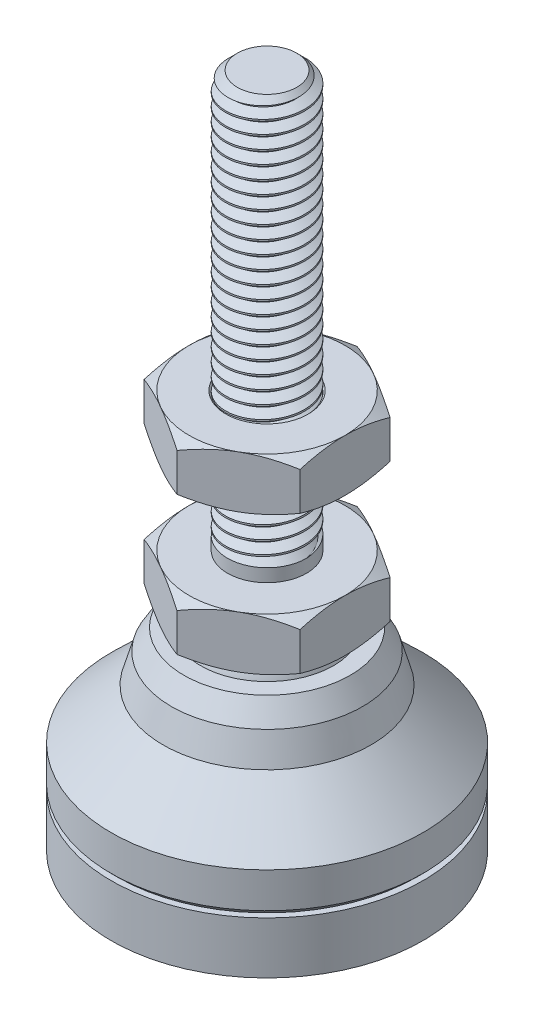
from build123d import *
from build123d.topology import SkipClean

# Parameters (mm, degrees)
BOSS_EXTRUDE1_DEPTH = 3.175
SKETCH6_R           = 2.413
BOSS_EXTRUDE2_DEPTH = 25.4
CUT_SWEEP1_PITCH    = 0.79375
CUT_SWEEP1_TO       = 25.4
SKETCH9_OUTSIDE_W   = 81.182
SKETCH9_OUTSIDE_H   = 81.182
SKETCH9_OUTSIDE_R   = 1.811518294
CUT_EXTRUDE1_DEPTH  = 25.4
CUT_EXTRUDE1_DRAFT  = -45
SKETCH10_R          = 2.413
BOSS_EXTRUDE3_DEPTH = 3.175
SKETCH14_W          = 9.525
SKETCH14_H          = 3.175


with BuildPart() as part:
    # Sketch2 → Revolve1 (revolve)
    with BuildSketch(Plane.XY, mode=Mode.PRIVATE) as revolve1_sk:
        with BuildLine():
            Line((0, 3.175), (0, 6.2865))
            ThreePointArc((0, 6.2865), (-3.428117942, 8.02132192), (-4.060525859, 11.811))
            Line((-4.060525859, 11.811), (-5.08, 11.811))
            Line((-5.08, 11.811), (-5.842, 10.541))
            Line((-5.842, 10.541), (-6.35, 8.763))
            Line((-6.35, 8.763), (-9.525, 5.715))
            Line((-9.525, 5.715), (-9.525, 3.556))
            Line((-9.525, 3.556), (-9.144, 3.175))
            Line((-9.144, 3.175), (0, 3.175))
        make_face()
    revolve(revolve1_sk.sketch.rotate(Axis((0, 0, 0), (0, 1, 0)), 270), axis=Axis((0, 0, 0), (0, 1, 0)))


with BuildPart() as body_2:
    # Sketch12 → Revolve2 (revolve)
    with BuildSketch(Plane.XY, mode=Mode.PRIVATE) as revolve2_sk:
        with BuildLine():
            Line((0, 12.7), (-3.665990896, 12.7))
            ThreePointArc((-3.665990896, 12.7), (-3.693659144, 8.429684681), (0, 6.2865))
            Line((0, 6.2865), (0, 12.7))
        make_face()
    revolve(revolve2_sk.sketch.rotate(Axis((0, 12.7, 0), (0, -1, 0)), 180), axis=Axis((0, 12.7, 0), (0, -1, 0)))

    # Sketch4 → Boss-Extrude1 (add)
    with BuildSketch(Plane(origin=(0, 12.7, 0), x_dir=(1, 0, 0), z_dir=(0, 1, 0))):
        Polygon((0, 5.499261314), (-4.7625, 2.749630657), (-4.7625, -2.749630657), (0, -5.499261314), (4.7625, -2.749630657), (4.7625, 2.749630657), align=None)
    extrude(amount=BOSS_EXTRUDE1_DEPTH)

    # Sketch5 → Cut-Revolve2 (revolve, cut)
    with BuildSketch(Plane(origin=(0, 0, 0), x_dir=(0, 0, -1), z_dir=(1, 0, 0)), mode=Mode.PRIVATE) as cut_revolve2_sk:
        Polygon((-6.236022628, 15.875), (-6.236022628, 12.7), (-4.7625, 12.7), (-5.499261314, 13.125369343), (-5.499261314, 15.449630657), (-4.7625, 15.875), align=None)
    revolve(cut_revolve2_sk.sketch.rotate(Axis((0, 0, 0), (0, 1, 0)), 90), axis=Axis((0, 0, 0), (0, 1, 0)), mode=Mode.SUBTRACT)


with BuildPart() as body_3:
    # Sketch6 → Boss-Extrude2 (new body)
    with BuildSketch(Plane(origin=(0, 15.875, 0), x_dir=(1, 0, 0), z_dir=(0, 1, 0))):
        with Locations(Location((0, 0, 0), (0, 0, 270))):
            Circle(SKETCH6_R)
    extrude(amount=BOSS_EXTRUDE2_DEPTH)

    # Cut-Sweep1: arcs per turn and ends read off the stored shape
    # Cut-Sweep1: the profile of Sketch8 screwed along a right-hand helix through 34 turns, 8 arcs to a turn; built about Z, then put on its axis
    cut_sweep1_z = Axis((0, 0, 0), (0, 0, 1))
    cut_sweep1_corners = [(2.455962979, 0, -1.513085938), (1.897444252, 0, -1.190625), (1.897444252, 0, -1.09140625), (2.455962979, 0, -0.768945313)]
    with BuildLine(mode=Mode.PRIVATE) as cut_sweep1_profile:
        Line(cut_sweep1_corners[0], cut_sweep1_corners[1])
        Line(cut_sweep1_corners[1], cut_sweep1_corners[2])
        Line(cut_sweep1_corners[2], cut_sweep1_corners[3])
        Line(cut_sweep1_corners[3], cut_sweep1_corners[0])
    cut_sweep1_cap = Face(cut_sweep1_profile.wire())
    cut_sweep1_turn_angles = [0, 22.5, 45, 67.5, 90, 112.5, 135, 157.5, 180, 202.5, 225, 247.5, 270, 292.5, 315, 337.5, 360]
    cut_sweep1_turn_weights = [1, 0.9238795325112867, 1, 0.9238795325112867, 1, 0.9238795325112867, 1, 0.9238795325112867, 1, 0.9238795325112867, 1, 0.9238795325112867, 1, 0.9238795325112867, 1, 0.9238795325112867, 1]
    cut_sweep1_turn_rails = [Edge.make_bspline([Vector(p[0], p[1], 0).rotate(cut_sweep1_z, cut_sweep1_turn_angles[k]) / cut_sweep1_turn_weights[k] + Vector(0, 0, p[2] + CUT_SWEEP1_PITCH * cut_sweep1_turn_angles[k] / 360) for k in range(17)], [0, 0, 0, 1, 1, 2, 2, 3, 3, 4, 4, 5, 5, 6, 6, 7, 7, 8, 8, 8], 2, cut_sweep1_turn_weights) for p in cut_sweep1_corners]
    cut_sweep1_turn_sides = [Face.make_surface_from_curves(cut_sweep1_turn_rails[p[0]], cut_sweep1_turn_rails[p[1]]) for p in [(0, 1), (1, 2), (2, 3), (3, 0)]]
    cut_sweep1 = Plane(origin=(0, 41.275, 0), x_dir=(1, 0, 0), z_dir=(0, -1, 0)) * split(Solid(Shell([*[p.moved(Location((0, 0, CUT_SWEEP1_PITCH * i))) for i in range(34) for p in cut_sweep1_turn_sides], cut_sweep1_cap, cut_sweep1_cap.rotate(cut_sweep1_z, 12240).moved(Location((0, 0, CUT_SWEEP1_PITCH * 12240 / 360)))])), bisect_by=Plane.XY.offset(CUT_SWEEP1_TO), keep=Keep.BOTTOM, mode=Mode.PRIVATE)
    add(cut_sweep1, mode=Mode.SUBTRACT)


with BuildPart() as cut_extrude1_tool:
    # Sketch9 outside → Cut-Extrude1 (with draft: the straight prism first)
    with BuildSketch(Plane(origin=(0, 41.275, 0), x_dir=(1, 0, 0), z_dir=(0, 1, 0))):
        Rectangle(SKETCH9_OUTSIDE_W, SKETCH9_OUTSIDE_H)
        Circle(SKETCH9_OUTSIDE_R, mode=Mode.SUBTRACT)
    extrude(amount=-CUT_EXTRUDE1_DEPTH)
    # Cut-Extrude1: the draft: its side faces are tilted about the plane it starts from
    cut_extrude1_sides = [cut_extrude1_tool.faces().sort_by_distance(p)[0] for p in [
        (0, 28.575, 40.591),
        (40.591, 28.575, 0),
        (0, 28.575, -40.591),
        (-40.591, 28.575, 0),
        (-1.811518294, 28.575, 0),
    ]]
    draft(cut_extrude1_sides, Plane(origin=(0, 41.275, 0), x_dir=(1, 0, 0), z_dir=(0, 1, 0)), CUT_EXTRUDE1_DRAFT)


with BuildPart() as body_3_1:
    add(body_3.part)

    # Cut-Extrude1: cut by cut_extrude1_tool
    add(cut_extrude1_tool.part, mode=Mode.SUBTRACT)

    # Combine1: union body 2
    add(body_2.part)

    # Sketch13 → Revolve3 (revolve)
    with SkipClean():  # the faces are left unmerged after this step: merging them gives an invalid solid
        with BuildSketch(Plane.XY, mode=Mode.PRIVATE) as revolve3_sk:
            Polygon((0, 19.08175), (2.413, 16.66875), (2.413, 15.875), (0, 15.875), align=None)
        revolve(revolve3_sk.sketch.rotate(Axis((0, 19.08175, 0), (0, -1, 0)), 272.921710335), axis=Axis((0, 19.08175, 0), (0, -1, 0)))


with BuildPart() as body_3_2:
    # Sketch10 → Boss-Extrude3 (new body)
    with BuildSketch(Plane(origin=(0, 24.341666667, 0), x_dir=(-1, 0, 0), z_dir=(0, 1, 0))):
        Polygon((0, 5.499261314), (-4.7625, 2.749630657), (-4.7625, -2.749630657), (0, -5.499261314), (4.7625, -2.749630657), (4.7625, 2.749630657), align=None)
        with Locations(Location((0, 0, 0), (0, 0, 90))):
            Circle(SKETCH10_R, mode=Mode.SUBTRACT)
    extrude(amount=-BOSS_EXTRUDE3_DEPTH)

    # Sketch11 → Cut-Revolve3 (revolve, cut)
    with BuildSketch(Plane(origin=(0, 0, 0), x_dir=(0, 0, -1), z_dir=(1, 0, 0)), mode=Mode.PRIVATE) as cut_revolve3_sk:
        Polygon((-6.236022628, 21.166666667), (-6.236022628, 24.341666667), (-4.7625, 24.341666667), (-5.499261314, 23.916297324), (-5.499261314, 21.59203601), (-4.7625, 21.166666667), align=None)
        Polygon((0, 21.166666667), (0, 24.341666667), (2.51221875, 24.341666667), (2.413, 24.242447917), (2.413, 21.265885417), (2.51221875, 21.166666667), align=None)
    revolve(cut_revolve3_sk.sketch.rotate(Axis((0, 0, 0), (0, 1, 0)), 177.078289665), axis=Axis((0, 0, 0), (0, 1, 0)), mode=Mode.SUBTRACT)


with BuildPart() as body_4:
    # Sketch14 → Revolve4 (revolve)
    with BuildSketch(Plane.XY, mode=Mode.PRIVATE) as revolve4_sk:
        with Locations((4.7625, 1.5875)):
            Rectangle(SKETCH14_W, SKETCH14_H)
    revolve(revolve4_sk.sketch.rotate(Axis((0, 0, 0), (0, 1, 0)), 87.078289665), axis=Axis((0, 0, 0), (0, 1, 0)))


solid = Compound([part.part, body_3_1.part, body_3_2.part, body_4.part])
